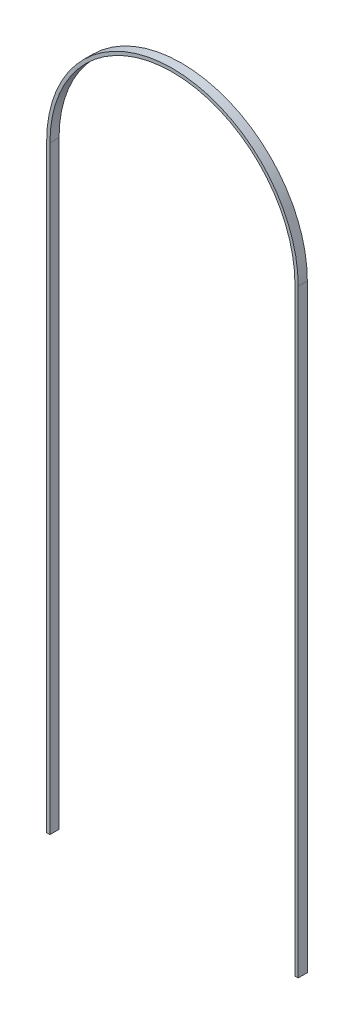
from build123d import *

# Parameters (mm, degrees)
SKETCH1_W             = 25
SKETCH1_H             = 4897
BOSS_EXTRUDE1_DEPTH   = 70
BOSS_EXTRUDE1_2_DEPTH = 70
BOSS_EXTRUDE1_3_DEPTH = 70


# Read off the part's stored shape, not the designer's step: Split1
with BuildPart() as part:
    # Sketch1 → Boss-Extrude1 (new body)
    with BuildSketch(Plane.XY):
        with Locations((-732.5, -2448.5)):
            Rectangle(SKETCH1_W, SKETCH1_H)
    extrude(amount=BOSS_EXTRUDE1_DEPTH)


with BuildPart() as body_2:
    # Sketch1 → Boss-Extrude1 2 (new body)
    with BuildSketch(Plane.XY):
        with Locations((732.5, -2448.5)):
            Rectangle(SKETCH1_W, SKETCH1_H)
    extrude(amount=BOSS_EXTRUDE1_2_DEPTH)


with BuildPart() as body_3:
    # Sketch1 → Boss-Extrude1 3 (new body)
    with BuildSketch(Plane.XY):
        with BuildLine():
            Line((940, 0), (940, -4597))
            Line((940, -4597), (965, -4597))
            Line((965, -4597), (965, 0))
            ThreePointArc((965, 0), (0, 965), (-965, 0))
            Line((-965, 0), (-965, -4597))
            Line((-965, -4597), (-940, -4597))
            Line((-940, -4597), (-940, 0))
            ThreePointArc((-940, 0), (0, 940), (940, 0))
        make_face()
    extrude(amount=BOSS_EXTRUDE1_3_DEPTH)


solid = body_3.part
